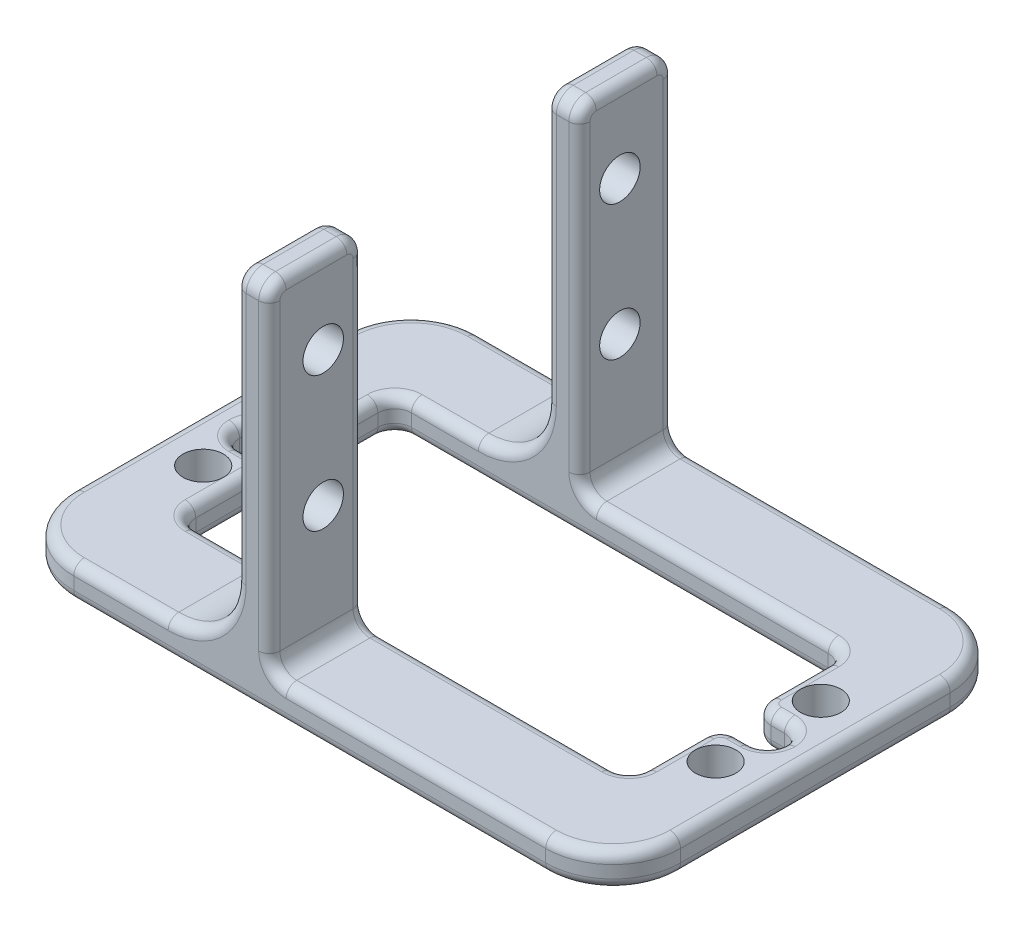
from build123d import *

# Parameters (mm, degrees)
SKETCH1_W           = 57.15
SKETCH1_H           = 38.1
BOSS_EXTRUDE1_DEPTH = 3.175
SKETCH2_R           = 1.905
CUT_EXTRUDE1_DEPTH  = 35.48932806
SKETCH3_W           = 3.175
SKETCH3_H           = 8.89
BOSS_EXTRUDE2_DEPTH = 31.75
SKETCH4_R           = 1.905
CUT_EXTRUDE2_DEPTH  = 54.358895463
FILLET1_R           = 1.5875
FILLET2_R           = 6.35
FILLET3_R           = 1


with BuildPart() as part:
    # Sketch1 → Boss-Extrude1 (new body)
    with BuildSketch(Plane(origin=(0, 0, 0), x_dir=(1, 0, 0), z_dir=(0, 1, 0))):
        Rectangle(SKETCH1_W, SKETCH1_H)
    extrude(amount=BOSS_EXTRUDE1_DEPTH)

    # Sketch2 → Cut-Extrude1 (cut, through all)
    with BuildSketch(Plane(origin=(0, 3.175, 0), x_dir=(1, 0, 0), z_dir=(0, 1, 0))):
        with Locations(Location((-24.13, -4.953, 0), (0, 0, 270))):
            Circle(SKETCH2_R)
        with Locations(Location((-24.13, 4.953, 0), (0, 0, 270))):
            Circle(SKETCH2_R)
        with Locations(Location((24.13, 4.953, 0), (0, 0, 270))):
            Circle(SKETCH2_R)
        with Locations(Location((24.13, -4.953, 0), (0, 0, 270))):
            Circle(SKETCH2_R)
        Polygon((-21.209, -10.16), (21.209, -10.16), (21.209, -1.5875), (25.654, -1.5875), (25.654, 1.5875), (21.209, 1.5875), (21.209, 10.16), (-21.209, 10.16), (-21.209, 1.5875), (-25.654, 1.5875), (-25.654, -1.5875), (-21.209, -1.5875), align=None)
    extrude(amount=-CUT_EXTRUDE1_DEPTH, mode=Mode.SUBTRACT)

    # Sketch3 → Boss-Extrude2 (add)
    with BuildSketch(Plane(origin=(0, 3.175, 0), x_dir=(1, 0, 0), z_dir=(0, 1, 0))):
        with Locations((-5.3975, -14.605)):
            Rectangle(SKETCH3_W, SKETCH3_H)
        with Locations((-5.3975, 14.605)):
            Rectangle(SKETCH3_W, SKETCH3_H)
    extrude(amount=BOSS_EXTRUDE2_DEPTH)

    # Sketch4 → Cut-Extrude2 (cut, through all)
    with BuildSketch(Plane.ZY.offset(6.985)):
        with Locations((13.97, 27.305)):
            Circle(SKETCH4_R)
        with Locations((-13.97, 27.305)):
            Circle(SKETCH4_R)
        with Locations((-13.97, 14.605)):
            Circle(SKETCH4_R)
        with Locations((13.97, 14.605)):
            Circle(SKETCH4_R)
    extrude(amount=-CUT_EXTRUDE2_DEPTH, mode=Mode.SUBTRACT)

    # Fillet1
    fillet1_edges = [part.edges().sort_by_distance(p)[0] for p in [
        (-3.81, 3.175, -14.605),
        (-3.81, 3.175, 14.605),
        (-21.209, 1.5875, -10.16),
        (-21.209, 1.5875, 10.16),
        (-21.209, 1.5875, -1.5875),
        (-21.209, 1.5875, 1.5875),
        (-25.654, 1.5875, 1.5875),
        (-25.654, 1.5875, -1.5875),
        (21.209, 1.5875, -10.16),
        (21.209, 1.5875, -1.5875),
        (25.654, 1.5875, -1.5875),
        (25.654, 1.5875, 1.5875),
        (21.209, 1.5875, 1.5875),
        (21.209, 1.5875, 10.16),
        (-5.3975, 34.925, -10.16),
        (-5.3975, 34.925, -19.05),
        (-5.3975, 34.925, 19.05),
        (-5.3975, 34.925, 10.16),
    ]]
    fillet(fillet1_edges, radius=FILLET1_R - 0.0001)  # a hair under: the kernel refuses the full size

    # Fillet2
    fillet2_edges = [part.edges().sort_by_distance(p)[0] for p in [
        (-6.985, 3.175, -14.605),
        (-6.985, 3.175, 14.605),
        (28.575, 1.5875, 19.05),
        (28.575, 1.5875, -19.05),
        (-28.575, 1.5875, -19.05),
        (-28.575, 1.5875, 19.05),
    ]]
    fillet(fillet2_edges, radius=FILLET2_R)

    # Fillet3
    fillet3_edges = [part.edges().sort_by_distance(p)[0] for p in [
        (-6.985, 34.925, -14.605),
        (-3.81, 34.925, -14.605),
        (-3.81, 19.05, -19.05),
        (-3.81, 19.05, -10.16),
        (-3.81, 34.460061304, -18.585061304),
        (-3.81, 34.460061304, -10.624938696),
        (8.6995, 3.175, -10.16),
        (-6.985, 21.4313, -10.16),
        (0, 0, -10.16),
        (-6.985, 21.4313, -19.05),
        (-6.985, 34.460061304, -18.585061304),
        (-6.985, 34.460061304, -10.624938696),
        (-6.985, 34.925, 14.605),
        (-3.81, 34.925, 14.605),
        (-3.81, 19.05, 10.16),
        (-3.81, 19.05, 19.05),
        (-3.81, 34.460061304, 10.624938696),
        (-3.81, 34.460061304, 18.585061304),
        (10.0012, 3.175, 19.05),
        (-6.985, 21.4313, 19.05),
        (-6.985, 21.4313, 10.16),
        (-6.985, 34.460061304, 10.624938696),
        (-6.985, 34.460061304, 18.585061304),
        (-16.4783, 3.175, 10.16),
        (8.6995, 3.175, 10.16),
        (0, 0, 10.16),
        (21.209, 3.175, -5.87375),
        (23.4315, 3.175, -1.5875),
        (23.4315, 3.175, 1.5875),
        (21.209, 3.175, 5.87375),
        (21.673938696, 3.175, 2.052438696),
        (21.673938696, 3.175, -2.052438696),
        (-21.209, 3.175, -5.87375),
        (-21.209, 0, -5.87375),
        (-21.209, 3.175, 5.87375),
        (-21.209, 0, 5.87375),
        (-23.4315, 3.175, -1.5875),
        (-23.4315, 0, -1.5875),
        (-23.4315, 3.175, 1.5875),
        (-21.673938696, 3.175, 2.052438696),
        (-21.673938696, 3.175, -2.052438696),
        (21.209, 0, -5.87375),
        (-23.4315, 0, 1.5875),
        (21.209, 0, 5.87375),
        (23.4315, 0, 1.5875),
        (23.4315, 0, -1.5875),
        (21.673938696, 0, 2.052438696),
        (21.673938696, 0, -2.052438696),
        (-21.673938696, 0, 2.052438696),
        (-21.673938696, 0, -2.052438696),
        (-3.345061304, 3.639938696, -19.05),
        (-3.345061304, 3.639938696, -10.16),
        (-3.345061304, 3.639938696, 10.16),
        (-3.345061304, 3.639938696, 19.05),
        (-20.744061304, 3.175, -9.695061304),
        (-20.744061304, 0, -9.695061304),
        (-20.744061304, 3.175, 9.695061304),
        (-20.744061304, 0, 9.695061304),
        (-25.189061304, 3.175, 1.122561304),
        (-25.189061304, 0, 1.122561304),
        (-25.189061304, 3.175, -1.122561304),
        (-25.189061304, 0, -1.122561304),
        (20.744061304, 3.175, -9.695061304),
        (20.744061304, 0, -9.695061304),
        (25.189061304, 3.175, -1.122561304),
        (25.189061304, 0, -1.122561304),
        (25.189061304, 3.175, 1.122561304),
        (25.189061304, 0, 1.122561304),
        (20.744061304, 3.175, 9.695061304),
        (20.744061304, 0, 9.695061304),
        (28.575, 0, 0),
        (28.575, 3.175, 0),
        (0, 0, 19.05),
        (-28.575, 0, 0),
        (0, 0, -19.05),
        (-26.715128061, 0, 17.190128061),
        (-26.715128061, 0, -17.190128061),
        (26.715128061, 0, -17.190128061),
        (26.715128061, 0, 17.190128061),
        (-17.78, 3.175, 19.05),
        (10.0012, 3.175, -19.05),
        (26.715128061, 3.175, -17.190128061),
        (26.715128061, 3.175, 17.190128061),
        (-17.78, 3.175, -19.05),
        (-28.575, 3.175, 0),
        (-16.4783, 3.175, -10.16),
        (-26.715128061, 3.175, 17.190128061),
        (-26.715128061, 3.175, -17.190128061),
        (-8.844871939, 5.034871939, -10.16),
        (-8.844871939, 5.034871939, -19.05),
        (-8.844871939, 5.034871939, 19.05),
        (-8.844871939, 5.034871939, 10.16),
    ]]
    fillet(fillet3_edges, radius=FILLET3_R)


solid = part.part
